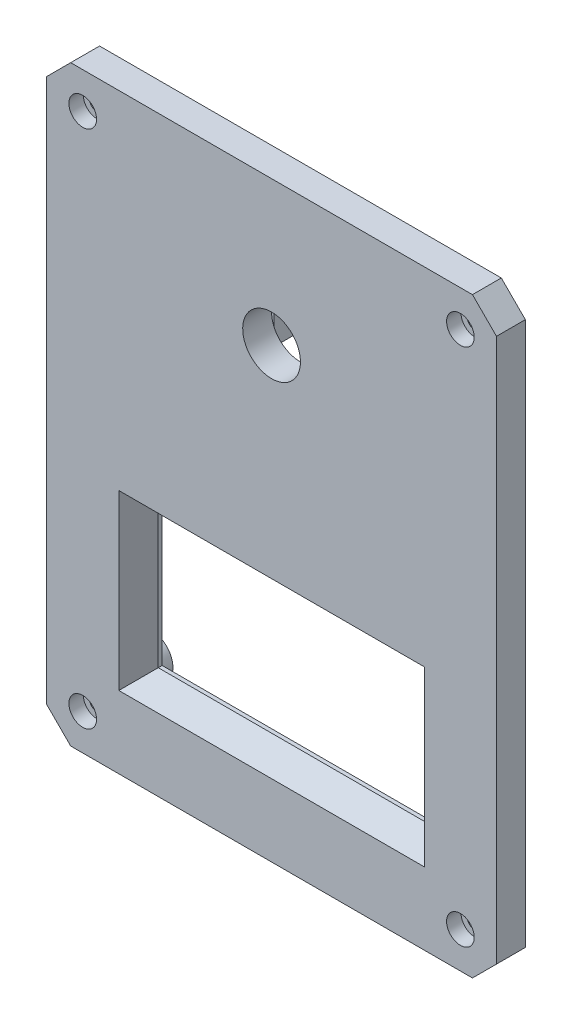
from build123d import *

# Parameters (mm, degrees)
SKETCH1_W           = 93.5
SKETCH1_H           = 123
SKETCH1_R           = 6
SKETCH1_W_2         = 57.5
SKETCH1_H_2         = 30
BOSS_EXTRUDE1_DEPTH = 6
SKETCH2_R           = 4.5
SKETCH2_R_2         = 2.1
BOSS_EXTRUDE2_DEPTH = 3
CHAMFER2_SIZE       = 5
SKETCH5_R           = 2.875
CUT_EXTRUDE2_DEPTH  = 3
SKETCH6_R           = 1.625
CUT_EXTRUDE3_DEPTH  = 23
SKETCH7_W           = 8
SKETCH7_H           = 24.8
SKETCH7_R           = 2.1
SKETCH7_W_2         = 5
SKETCH7_H_2         = 12
BOSS_EXTRUDE3_DEPTH = 6
CHAMFER3_SIZE       = 3
CHAMFER3_SIZE2      = 5.196152423
SKETCH9_R           = 2.1
CUT_EXTRUDE5_DEPTH  = 3


with BuildPart() as part:
    # Sketch1 → Boss-Extrude1 (new body)
    with BuildSketch(Plane.XY):
        with Locations((0, 28.5)):
            Rectangle(SKETCH1_W, SKETCH1_H)
        with Locations((0, 60)):
            Circle(SKETCH1_R, mode=Mode.SUBTRACT)
        Rectangle(SKETCH1_W_2, SKETCH1_H_2, mode=Mode.SUBTRACT)
    extrude(amount=BOSS_EXTRUDE1_DEPTH)

    # Sketch2 → Boss-Extrude2 (add)
    # profile 1 of 4: a face of its own
    with BuildSketch(Plane(origin=(0, 0, 0), x_dir=(-1, 0, 0), z_dir=(0, 0, -1))):
        with Locations((34, -17.25)):
            Circle(SKETCH2_R)
        with Locations((34, -17.25)):
            Circle(SKETCH2_R_2, mode=Mode.SUBTRACT)
    # profile 2 of 4: a face of its own
    with BuildSketch(Plane(origin=(0, 0, 0), x_dir=(-1, 0, 0), z_dir=(0, 0, -1))):
        with Locations((34, 21.75)):
            Circle(SKETCH2_R)
        with Locations((34, 21.75)):
            Circle(SKETCH2_R_2, mode=Mode.SUBTRACT)
    # profile 3 of 4: a face of its own
    with BuildSketch(Plane(origin=(0, 0, 0), x_dir=(-1, 0, 0), z_dir=(0, 0, -1))):
        with Locations((-34, -17.25)):
            Circle(SKETCH2_R)
        with Locations((-34, -17.25)):
            Circle(SKETCH2_R_2, mode=Mode.SUBTRACT)
    # profile 4 of 4: a face of its own
    with BuildSketch(Plane(origin=(0, 0, 0), x_dir=(-1, 0, 0), z_dir=(0, 0, -1))):
        with Locations((-34, 21.75)):
            Circle(SKETCH2_R)
        with Locations((-34, 21.75)):
            Circle(SKETCH2_R_2, mode=Mode.SUBTRACT)
    extrude(amount=BOSS_EXTRUDE2_DEPTH)

    # Chamfer2
    chamfer2_edges = [part.edges().sort_by_distance(p)[0] for p in [
        (46.75, -33, 3),
        (-46.75, -33, 3),
        (-46.75, 90, 3),
        (46.75, 90, 3),
    ]]
    chamfer(chamfer2_edges, length=CHAMFER2_SIZE)

    # Sketch5 → Cut-Extrude2 (cut)
    with BuildSketch(Plane.XY.offset(6)):
        with Locations((39.25, -25.5)):
            Circle(SKETCH5_R)
        with Locations((39.25, 82.5)):
            Circle(SKETCH5_R)
        with Locations((-39.25, -25.5)):
            Circle(SKETCH5_R)
        with Locations((-39.25, 82.5)):
            Circle(SKETCH5_R)
    extrude(amount=-CUT_EXTRUDE2_DEPTH, mode=Mode.SUBTRACT)

    # Sketch6 → Cut-Extrude3 (cut)
    with BuildSketch(Plane.XY.offset(3)):
        with Locations((39.25, -25.5)):
            Circle(SKETCH6_R)
        with Locations((-39.25, -25.5)):
            Circle(SKETCH6_R)
        with Locations((-39.25, 82.5)):
            Circle(SKETCH6_R)
        with Locations((39.25, 82.5)):
            Circle(SKETCH6_R)
    extrude(amount=-CUT_EXTRUDE3_DEPTH, mode=Mode.SUBTRACT)

    # Sketch7 → Boss-Extrude3 (add)
    # profile 1 of 2: a face of its own
    with BuildSketch(Plane.XY):
        with Locations((9.5, 60)):
            Rectangle(SKETCH7_W, SKETCH7_H)
        with Locations((8, 51.6)):
            Circle(SKETCH7_R, mode=Mode.SUBTRACT)
        with Locations((8, 68.4)):
            Circle(SKETCH7_R, mode=Mode.SUBTRACT)
    # profile 2 of 2: a face of its own
    with BuildSketch(Plane.XY):
        with Locations((-8, 60)):
            Rectangle(SKETCH7_W_2, SKETCH7_H_2)
    extrude(amount=-BOSS_EXTRUDE3_DEPTH)

    # Chamfer3
    chamfer3_edges = [part.edges().sort_by_distance(p)[0] for p in [
        (0, 15, 6),
        (28.75, 0, 6),
        (0, -15, 6),
        (-28.75, 0, 6),
    ]]
    chamfer3_side = [part.faces().sort_by_distance(p)[0] for p in [
        (0, 33.295685128, 6),
    ]]
    chamfer(chamfer3_edges, length=CHAMFER3_SIZE, length2=CHAMFER3_SIZE2, reference=chamfer3_side[0])

    # Sketch9 → Cut-Extrude5 (cut)
    with BuildSketch(Plane(origin=(0, 0, 0), x_dir=(-1, 0, 0), z_dir=(0, 0, -1))):
        with Locations((30, 75)):
            Circle(SKETCH9_R)
        with Locations((30, 45)):
            Circle(SKETCH9_R)
        with Locations((-30, 45)):
            Circle(SKETCH9_R)
        with Locations((-30, 75)):
            Circle(SKETCH9_R)
    extrude(amount=-CUT_EXTRUDE5_DEPTH, mode=Mode.SUBTRACT)


solid = part.part
